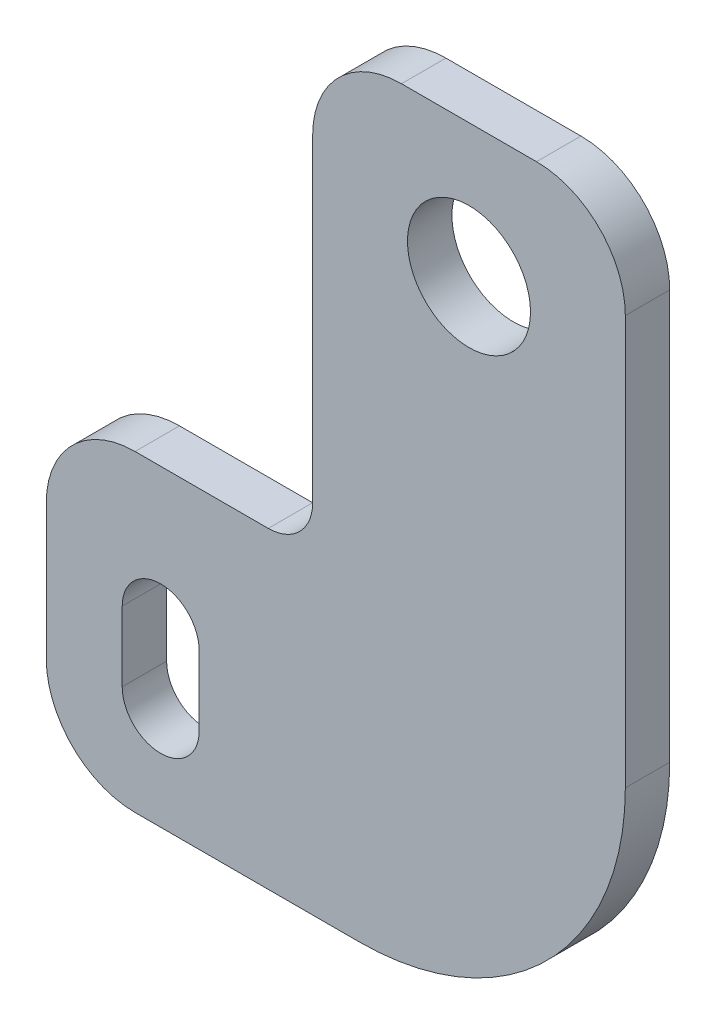
from build123d import *

# Parameters (mm, degrees)
BASE_FLANGE1_DEPTH = 3.175
FILLET1_R          = 6.35
FILLET2_R          = 19.05
FILLET3_R          = 3.175
SKETCH3_R          = 4.396875001
CUT_EXTRUDE1_DEPTH = 3.175


# Sheet-metal steps are written as plain solids
with BuildPart() as part:
    # Sketch1 → Base-Flange1 (new body)
    with BuildSketch(Plane.XY):
        Polygon((0, 0), (41.397840965, 0), (41.397840965, 54.644007143), (19.045840965, 54.644007143), (19.045840965, 22.352), (0, 22.352), align=None)
    extrude(amount=-BASE_FLANGE1_DEPTH)

    # Fillet1
    fillet1_edges = [part.edges().sort_by_distance(p)[0] for p in [
        (0, 22.352, -1.5875),
        (19.045840965, 54.644007143, -1.5875),
        (41.397840965, 54.644007143, -1.5875),
        (0, 0, -1.5875),
    ]]
    fillet(fillet1_edges, radius=FILLET1_R)

    # Fillet2
    fillet2_edges = [part.edges().sort_by_distance(p)[0] for p in [
        (41.397840965, 0, -1.5875),
    ]]
    fillet(fillet2_edges, radius=FILLET2_R)

    # Fillet3
    fillet3_edges = [part.edges().sort_by_distance(p)[0] for p in [
        (19.045840965, 22.352, -1.5875),
    ]]
    fillet(fillet3_edges, radius=FILLET3_R)

    # Sketch3 → Cut-Extrude1 (cut)
    with BuildSketch(Plane.XY):
        with Locations((30.221840965, 45.119007143)):
            Circle(SKETCH3_R)
        with BuildLine():
            Line((10.93094867, 12.325), (10.93094867, 7.325))
            ThreePointArc((10.93094867, 7.325), (8.18094867, 4.575), (5.43094867, 7.325))
            Line((5.43094867, 7.325), (5.43094867, 12.325))
            ThreePointArc((5.43094867, 12.325), (8.18094867, 15.075), (10.93094867, 12.325))
        make_face()
    extrude(amount=-CUT_EXTRUDE1_DEPTH, mode=Mode.SUBTRACT)


solid = part.part
